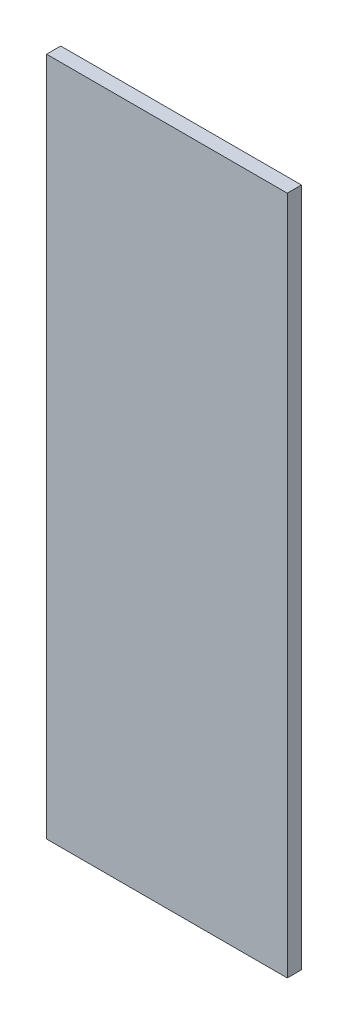
from build123d import *

# Parameters (mm, degrees)
SKETCH1_W           = 107.95
SKETCH1_H           = 304.8
BOSS_EXTRUDE1_DEPTH = 6.35


with BuildPart() as part:
    # Sketch1 → Boss-Extrude1 (new body)
    with BuildSketch(Plane.XY):
        Rectangle(SKETCH1_W, SKETCH1_H)
    extrude(amount=BOSS_EXTRUDE1_DEPTH)


solid = part.part
